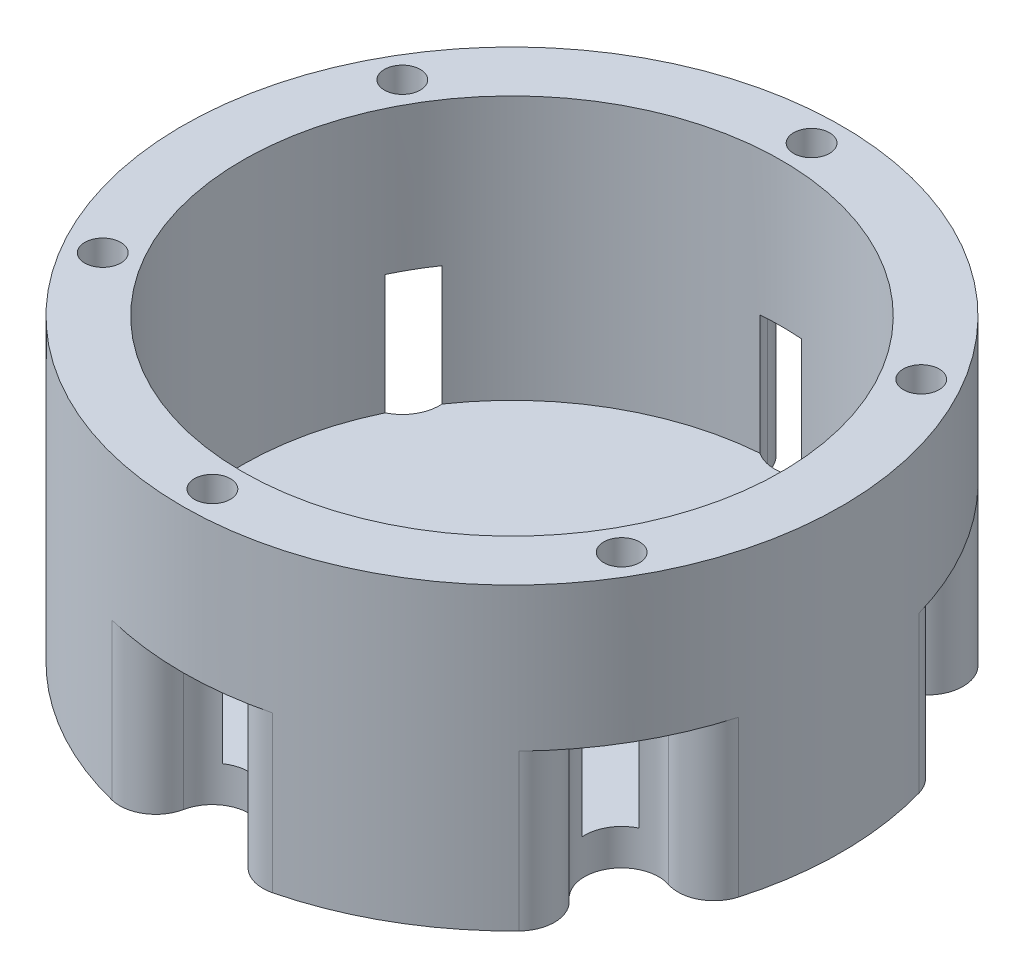
from build123d import *

# Parameters (mm, degrees)
SKETCH1_R                = 27.5
SKETCH1_R_2              = 1.5
BOSS_EXTRUDE1_DEPTH      = 25
SKETCH2_R                = 22.5
CUT_EXTRUDE1_DEPTH       = 22
SKETCH3_R                = 3.1
CUT_EXTRUDE2_DEPTH       = 13
FILLET1_R                = 3
CIRPATTERN1_COUNT        = 6
FILLET1_OF_CIRPATTERN1_R = 3


with BuildPart() as part:
    # Sketch1 → Boss-Extrude1 (new body)
    with BuildSketch(Plane(origin=(0, 0, 0), x_dir=(1, 0, 0), z_dir=(0, 1, 0))):
        Circle(SKETCH1_R)
        with Locations((0, 25)):
            Circle(SKETCH1_R_2, mode=Mode.SUBTRACT)
        with Locations((21.650635095, 12.5)):
            Circle(SKETCH1_R_2, mode=Mode.SUBTRACT)
        with Locations((21.650635095, -12.5)):
            Circle(SKETCH1_R_2, mode=Mode.SUBTRACT)
        with Locations((0, -25)):
            Circle(SKETCH1_R_2, mode=Mode.SUBTRACT)
        with Locations((-21.650635095, -12.5)):
            Circle(SKETCH1_R_2, mode=Mode.SUBTRACT)
        with Locations((-21.650635095, 12.5)):
            Circle(SKETCH1_R_2, mode=Mode.SUBTRACT)
    extrude(amount=BOSS_EXTRUDE1_DEPTH)

    # Sketch2 → Cut-Extrude1 (cut)
    with BuildSketch(Plane(origin=(0, 25, 0), x_dir=(1, 0, 0), z_dir=(0, 1, 0))):
        Circle(SKETCH2_R)
    extrude(amount=-CUT_EXTRUDE1_DEPTH, mode=Mode.SUBTRACT)

    # Sketch3 → Cut-Extrude2 (cut)
    with BuildSketch(Plane.XZ):
        with Locations((0, 25)):
            Circle(SKETCH3_R)
    cut_extrude2 = extrude(amount=-CUT_EXTRUDE2_DEPTH, mode=Mode.SUBTRACT)

    # Fillet1
    fillet1_edges = [part.edges().sort_by_distance(p)[0] for p in [
        (-1.921323544, 6.5, 27.4328),
        (1.921323544, 6.5, 27.4328),
    ]]
    fillet(fillet1_edges, radius=FILLET1_R)

    # CirPattern1: Cut-Extrude2 ×6 about axis
    cirpattern1_axis = Axis((0, 25, 0), (0, -1, 0))
    for i in range(1, CIRPATTERN1_COUNT):
        add(cut_extrude2.rotate(cirpattern1_axis, i * 360 / CIRPATTERN1_COUNT), mode=Mode.SUBTRACT)

    # Fillet1 of CirPattern1
    fillet1_of_cirpattern1_edges = [part.edges().sort_by_distance(p)[0] for p in [
        (-24.718163469, 6.5, 12.052485002),
        (-22.796839925, 6.5, 15.380314998),
        (-22.796839925, 6.5, -15.380314998),
        (-24.718163469, 6.5, -12.052485002),
        (1.921323544, 6.5, -27.4328),
        (-1.921323544, 6.5, -27.4328),
        (24.718163469, 6.5, -12.052485002),
        (22.796839925, 6.5, -15.380314998),
        (22.796839925, 6.5, 15.380314998),
        (24.718163469, 6.5, 12.052485002),
    ]]
    fillet(fillet1_of_cirpattern1_edges, radius=FILLET1_OF_CIRPATTERN1_R)


solid = part.part
